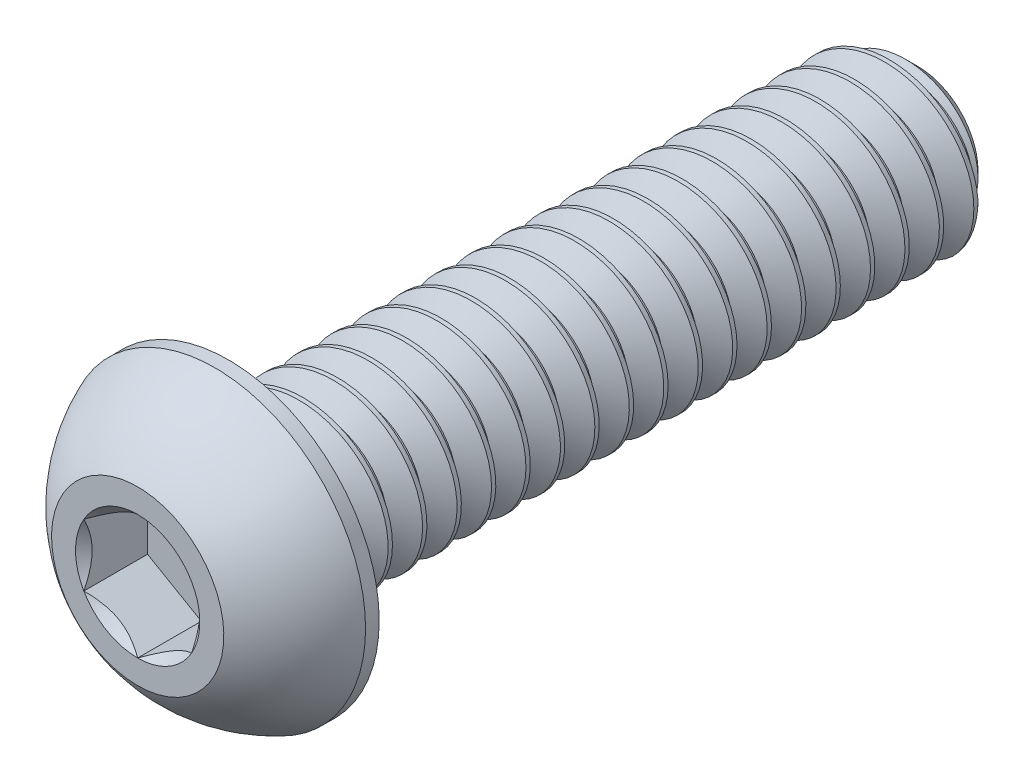
from build123d import *

# Parameters (mm, degrees)
SKETCH1_W          = 25.4
SKETCH1_H          = 3.175
CHAMFER1_SIZE      = 0.9525
CUT_SWEEP1_PITCH   = 1.27
CUT_EXTRUDE2_DEPTH = 2.34696


with BuildPart() as part:
    # Sketch1 → Revolve1 (revolve)
    with BuildSketch(Plane(origin=(0, 0, 0), x_dir=(0, 0, -1), z_dir=(1, 0, 0))):
        with Locations((16.0528, 1.5875)):
            Rectangle(SKETCH1_W, SKETCH1_H)
    revolve(axis=Axis((0, 0, -28.7528), (0, 0, 1)))

    # Chamfer1
    chamfer1_edges = [part.edges().sort_by_distance(p)[0] for p in [
        (0, -3.175, -28.7528),
    ]]
    chamfer(chamfer1_edges, length=CHAMFER1_SIZE)

    # Cut-Sweep1: the profile of Sketch2 profile screwed along a right-hand helix of 21 turns, 8 arcs to a turn; built about Z, then put on its axis
    cut_sweep1_z = Axis((0, 0, 0), (0, 0, 1))
    cut_sweep1_corners = [(3.1753, 0, 0.000173205), (3.1753, 0, -1.111423205), (2.350110803, 0, -0.635), (2.350110803, 0, -0.47625)]
    with BuildLine(mode=Mode.PRIVATE) as cut_sweep1_profile:
        Line(cut_sweep1_corners[0], cut_sweep1_corners[1])
        Line(cut_sweep1_corners[1], cut_sweep1_corners[2])
        Line(cut_sweep1_corners[2], cut_sweep1_corners[3])
        Line(cut_sweep1_corners[3], cut_sweep1_corners[0])
    cut_sweep1_cap = Face(cut_sweep1_profile.wire())
    cut_sweep1_turn_angles = [0, 22.5, 45, 67.5, 90, 112.5, 135, 157.5, 180, 202.5, 225, 247.5, 270, 292.5, 315, 337.5, 360]
    cut_sweep1_turn_weights = [1, 0.9238795325112867, 1, 0.9238795325112867, 1, 0.9238795325112867, 1, 0.9238795325112867, 1, 0.9238795325112867, 1, 0.9238795325112867, 1, 0.9238795325112867, 1, 0.9238795325112867, 1]
    cut_sweep1_turn_rails = [Edge.make_bspline([Vector(p[0], p[1], 0).rotate(cut_sweep1_z, cut_sweep1_turn_angles[k]) / cut_sweep1_turn_weights[k] + Vector(0, 0, p[2] + CUT_SWEEP1_PITCH * cut_sweep1_turn_angles[k] / 360) for k in range(17)], [0, 0, 0, 1, 1, 2, 2, 3, 3, 4, 4, 5, 5, 6, 6, 7, 7, 8, 8, 8], 2, cut_sweep1_turn_weights) for p in cut_sweep1_corners]
    cut_sweep1_turn_sides = [Face.make_surface_from_curves(cut_sweep1_turn_rails[p[0]], cut_sweep1_turn_rails[p[1]]) for p in [(0, 1), (1, 2), (2, 3), (3, 0)]]
    cut_sweep1 = Plane(origin=(0, 0, -28.7528), x_dir=(0, 1, 0), z_dir=(0, 0, 1)) * Solid(Shell([*[p.moved(Location((0, 0, CUT_SWEEP1_PITCH * i))) for i in range(21) for p in cut_sweep1_turn_sides], cut_sweep1_cap, cut_sweep1_cap.rotate(cut_sweep1_z, 7560).moved(Location((0, 0, CUT_SWEEP1_PITCH * 7560 / 360)))]))
    add(cut_sweep1, mode=Mode.SUBTRACT)

    # Sketch7 → Revolve2 (revolve)
    with BuildSketch(Plane(origin=(0, 0, 0), x_dir=(0, 0, -1), z_dir=(1, 0, 0)), mode=Mode.PRIVATE) as revolve2_sk:
        with BuildLine():
            Line((2.84988, 5.5499), (3.3528, 5.5499))
            Line((3.3528, 5.5499), (3.3528, 0))
            Line((3.3528, 0), (0, 0))
            Line((0, 0), (0, 3.175))
            ThreePointArc((0, 3.175), (1.235921075, 4.58927271), (2.84988, 5.5499))
        make_face()
    revolve(revolve2_sk.sketch.rotate(Axis((0, 0, 0), (0, 0, -1)), 189.052465709), axis=Axis((0, 0, 0), (0, 0, -1)))

    # Sketch5 → Cut-Extrude2 (cut)
    with BuildSketch(Plane.XY):
        Polygon((1.984375, -1.14567944), (1.984375, 1.14567944), (0, 2.291358881), (-1.984375, 1.14567944), (-1.984375, -1.14567944), (0, -2.291358881), align=None)
    extrude(amount=-CUT_EXTRUDE2_DEPTH, mode=Mode.SUBTRACT)

    # Cut-Extrude3 cone 1 section (through the dimple's axis) → Cut-Extrude3 (revolve, cut)
    with BuildSketch(Plane(origin=(0, 0, 0), x_dir=(0, -1, 0), z_dir=(1, 0, 0))):
        Polygon((0, 0), (2.291358881, 0), (0, 2.291358881), align=None)
    revolve(axis=Axis((0, 0, 0), (0, 0, -1)), mode=Mode.SUBTRACT)


solid = part.part
